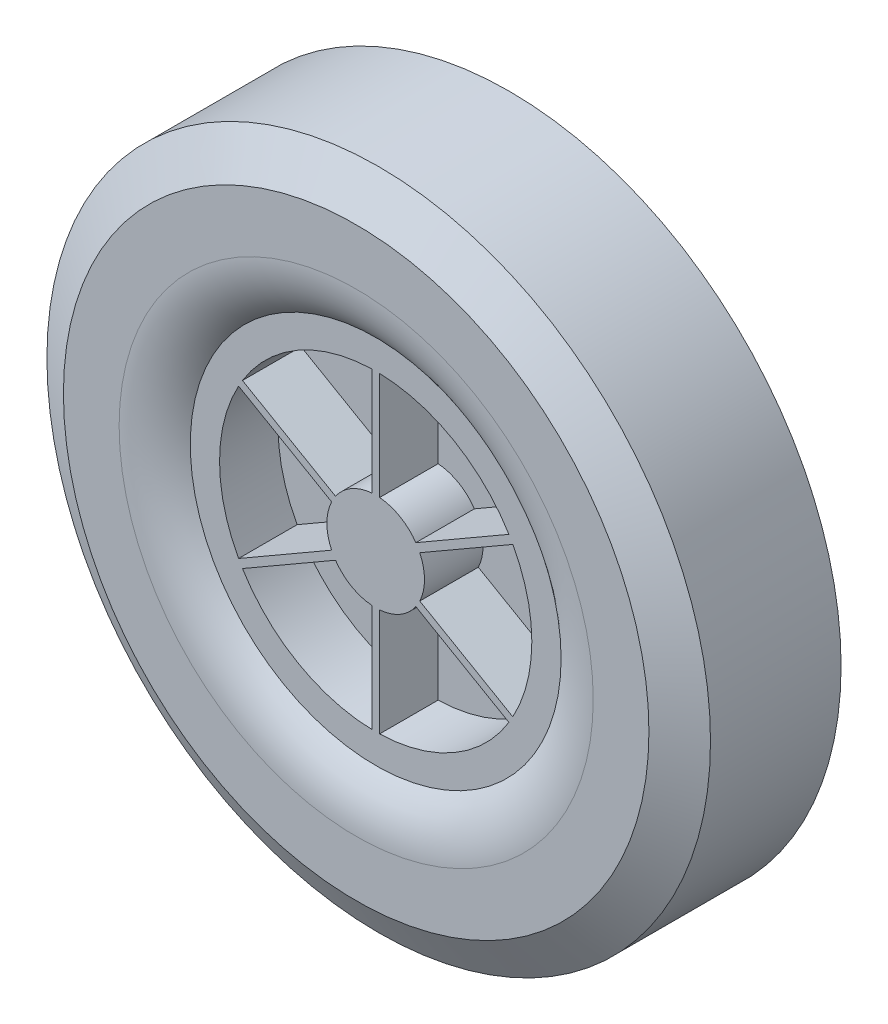
from build123d import *
from OCP.BRepFilletAPI import BRepFilletAPI_MakeChamfer

# Parameters (mm, degrees)
EXTRUDE1_DEPTH          = 28.575
EXTRUDE1_DEPTH_BACK     = 28.575
SKETCH1_R               = 107.95
CHAMFER1_SIZE           = 12.7
CHAMFER1_SIZE2          = 7.332348419
SKETCH2_R               = 60.325
EXTRUDE2_DEPTH          = 6.35
FILLET1_R               = 25.4
SKETCH5_R               = 50.8
EXTRUDE4_DEPTH          = 19.05
SKETCH6_W               = 2.54
SKETCH6_H               = 50.8
EXTRUDE_THIN1_DEPTH     = 19.05
CIRPATTERN2_COUNT       = 6
SKETCH7_R               = 15.875
EXTRUDE5_DEPTH          = 19.05
MIRROR4_COPY_1_SKETCH_W = 2.54
MIRROR4_COPY_1_SKETCH_H = 50.8
MIRROR4_COPY_1_DEPTH    = 19.05
MIRROR4_COPY_2_SKETCH_W = 2.54
MIRROR4_COPY_2_SKETCH_H = 50.8
MIRROR4_COPY_2_DEPTH    = 19.05
MIRROR4_COPY_3_SKETCH_W = 2.54
MIRROR4_COPY_3_SKETCH_H = 50.8
MIRROR4_COPY_3_DEPTH    = 19.05
MIRROR4_COPY_4_SKETCH_W = 2.54
MIRROR4_COPY_4_SKETCH_H = 50.8
MIRROR4_COPY_4_DEPTH    = 19.05
MIRROR4_COPY_5_SKETCH_W = 2.54
MIRROR4_COPY_5_SKETCH_H = 50.8
MIRROR4_COPY_5_DEPTH    = 19.05
FILLET2_R               = 25.4


with BuildPart() as part:
    # Sketch1 → Extrude1 (new, two sides: drawn at the far end of the back side and taken through both)
    with BuildSketch(Plane.XY.offset(-EXTRUDE1_DEPTH_BACK)):
        Circle(SKETCH1_R)
    extrude(amount=EXTRUDE1_DEPTH + EXTRUDE1_DEPTH_BACK)

    # Chamfer1: one chamfer whose edges measure the first distance from different faces: ONE call of the kernel's chamfer builder (chamfer() names one face for all edges)
    chamfer1_edges_1 = [part.edges().sort_by_distance(p)[0] for p in [
        (-107.95, 0, -28.575),
    ]]
    chamfer1_side_1 = [part.faces().sort_by_distance(p)[0] for p in [
        (0, 0, -28.575),
    ]]
    chamfer1_edges_2 = [part.edges().sort_by_distance(p)[0] for p in [
        (-107.95, 0, 28.575),
    ]]
    chamfer1_side_2 = [part.faces().sort_by_distance(p)[0] for p in [
        (0, 0, 28.575),
    ]]
    chamfer1 = BRepFilletAPI_MakeChamfer(part.part.solid().wrapped)
    for e in chamfer1_edges_1:
        chamfer1.Add(CHAMFER1_SIZE, CHAMFER1_SIZE2, e.wrapped, chamfer1_side_1[0].wrapped)  # the first distance lies on this face
    for e in chamfer1_edges_2:
        chamfer1.Add(CHAMFER1_SIZE, CHAMFER1_SIZE2, e.wrapped, chamfer1_side_2[0].wrapped)  # the first distance lies on this face
    add(Compound.cast(chamfer1.Shape()), mode=Mode.REPLACE)

    # Sketch2 → Extrude2 (cut)
    with BuildSketch(Plane.XY.offset(28.575)):
        Circle(SKETCH2_R)
    extrude2 = extrude(amount=-EXTRUDE2_DEPTH, mode=Mode.SUBTRACT)

    # Fillet1
    # the kernel refuses this fillet: 25.4 mm, written as the material it takes off along each edge
    with BuildSketch(Plane(origin=(0, 0, 28.575), x_dir=(1, 0, 0), z_dir=(0, -1, 0))) as fillet1_piece_1:
        with BuildLine():
            CenterArc((77.125520825, -25.4), FILLET1_R, 90, 41.409622109)
            Line((60.325, -6.35), (59.988989583, -5.969))
            ThreePointArc((59.988989583, -5.969), (59.817, -3.175), (59.817, 0))
            Line((59.817, 0), (60.325, 0.508))
            Line((60.325, 0.508), (77.125520825, 0.508))
            Line((77.125520825, 0.508), (77.125520825, 0))
        make_face()
    revolve(axis=Axis((0, 0, 28.575), (0, 0, 1)), mode=Mode.SUBTRACT)

    # Sketch5 → Extrude4 (cut)
    with BuildSketch(Plane.XY.offset(22.225)):
        Circle(SKETCH5_R)
    extrude4 = extrude(amount=-EXTRUDE4_DEPTH, mode=Mode.SUBTRACT)

    # Sketch6 → Extrude-Thin1 (add)
    with BuildSketch(Plane.XY.offset(3.175)):
        with Locations((0, 25.4)):
            Rectangle(SKETCH6_W, SKETCH6_H)
    extrude_thin1 = extrude(amount=EXTRUDE_THIN1_DEPTH)

    # CirPattern2: Extrude-Thin1 ×6 about axis
    cirpattern2_axis = Axis((0, 0, 0), (0, 0, 1))
    for i in range(1, CIRPATTERN2_COUNT):
        add(extrude_thin1.rotate(cirpattern2_axis, i * 360 / CIRPATTERN2_COUNT))

    # Sketch7 → Extrude5 (add)
    with BuildSketch(Plane.XY.offset(22.225)):
        Circle(SKETCH7_R)
    extrude5 = extrude(amount=-EXTRUDE5_DEPTH)

    # Mirror4: Extrude2, Extrude4, Extrude-Thin1, Extrude5 across plane
    add(extrude2.mirror(Plane.XY), mode=Mode.SUBTRACT)
    add(extrude4.mirror(Plane.XY), mode=Mode.SUBTRACT)
    add(extrude_thin1.mirror(Plane.XY))
    add(extrude5.mirror(Plane.XY))

    # Mirror4 copy 1 sketch → Mirror4 copy 1 (add)
    with BuildSketch(Plane(origin=(0, 0, -3.175), x_dir=(0.5000000000000001, 0.8660254037844386, 0), z_dir=(0, 0, -1))):
        with Locations((0, -25.4)):
            Rectangle(MIRROR4_COPY_1_SKETCH_W, MIRROR4_COPY_1_SKETCH_H)
    extrude(amount=MIRROR4_COPY_1_DEPTH)

    # Mirror4 copy 2 sketch → Mirror4 copy 2 (add)
    with BuildSketch(Plane(origin=(0, 0, -3.175), x_dir=(-0.4999999999999998, 0.8660254037844387, 0), z_dir=(0, 0, -1))):
        with Locations((0, -25.4)):
            Rectangle(MIRROR4_COPY_2_SKETCH_W, MIRROR4_COPY_2_SKETCH_H)
    extrude(amount=MIRROR4_COPY_2_DEPTH)

    # Mirror4 copy 3 sketch → Mirror4 copy 3 (add)
    with BuildSketch(Plane(origin=(0, 0, -3.175), x_dir=(-1, 0, 0), z_dir=(0, 0, -1))):
        with Locations((0, -25.4)):
            Rectangle(MIRROR4_COPY_3_SKETCH_W, MIRROR4_COPY_3_SKETCH_H)
    extrude(amount=MIRROR4_COPY_3_DEPTH)

    # Mirror4 copy 4 sketch → Mirror4 copy 4 (add)
    with BuildSketch(Plane(origin=(0, 0, -3.175), x_dir=(-0.5000000000000004, -0.8660254037844384, 0), z_dir=(0, 0, -1))):
        with Locations((0, -25.4)):
            Rectangle(MIRROR4_COPY_4_SKETCH_W, MIRROR4_COPY_4_SKETCH_H)
    extrude(amount=MIRROR4_COPY_4_DEPTH)

    # Mirror4 copy 5 sketch → Mirror4 copy 5 (add)
    with BuildSketch(Plane(origin=(0, 0, -3.175), x_dir=(0.5000000000000001, -0.8660254037844386, 0), z_dir=(0, 0, -1))):
        with Locations((0, -25.4)):
            Rectangle(MIRROR4_COPY_5_SKETCH_W, MIRROR4_COPY_5_SKETCH_H)
    extrude(amount=MIRROR4_COPY_5_DEPTH)

    # Fillet2
    # the kernel refuses this fillet: 25.4 mm, written as the material it takes off along each edge
    with BuildSketch(Plane(origin=(0, 0, -28.575), x_dir=(1, 0, 0), z_dir=(0, -1, 0))) as fillet2_piece_1:
        with BuildLine():
            CenterArc((77.125520825, 25.4), FILLET2_R, 228.590377891, 41.409622109)
            Line((60.325, 6.35), (59.988989583, 5.969))
            ThreePointArc((59.988989583, 5.969), (59.817, 3.175), (59.817, 0))
            Line((59.817, 0), (60.325, -0.508))
            Line((60.325, -0.508), (77.125520825, -0.508))
            Line((77.125520825, -0.508), (77.125520825, 0))
        make_face()
    revolve(axis=Axis((0, 0, -28.575), (0, 0, 1)), mode=Mode.SUBTRACT)


solid = part.part
